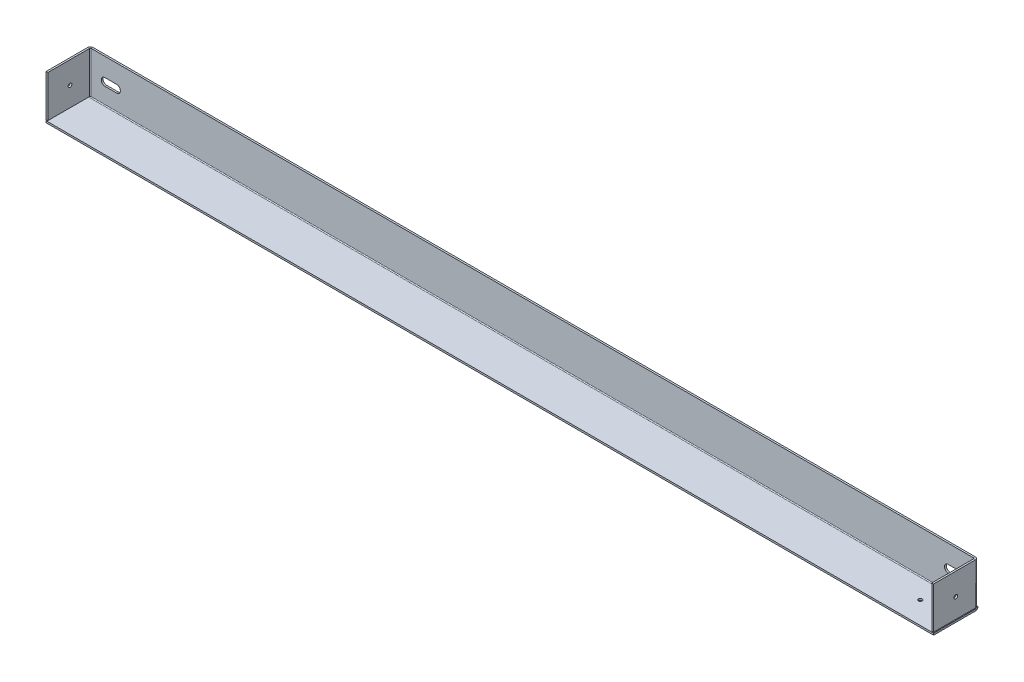
from build123d import *

# Parameters (mm, degrees)
BASEFLANGE_W                 = 1000
BASEFLANGE_H                 = 50
BASEFLANGE1_DEPTH            = 2
EDGE_FLANGE2_STRIP_W         = 10
EDGE_FLANGE2_STRIP_H         = 2
EDGE_FLANGE2_STRIP_CUT_DEPTH = 1000
EDGE_FLANGE2_DEPTH           = 1000
SKETCH12_R                   = 2.1
F_4_2MM_HOLE_DEPTH           = 10
SLOT_1_DEPTH                 = 10
LEFT_EDGE_STRIP_W            = 10
LEFT_EDGE_STRIP_H            = 2
LEFT_EDGE_STRIP_CUT_DEPTH    = 47
LEFT_EDGE_DEPTH              = 47
CUT_EXTRUDE1_DEPTH           = 1002.561281201
CUT_EXTRUDE1_DEPTH_BACK      = 1002.561281201
SKETCH19_R                   = 2.1
RIGHT_EDGE_STRIP_W           = 10
RIGHT_EDGE_STRIP_H           = 2
RIGHT_EDGE_STRIP_CUT_DEPTH   = 47
RIGHT_EDGE_DEPTH             = 47
CUT_EXTRUDE2_START           = -10
SKETCH25_R                   = 2.1
CUT_EXTRUDE2_DEPTH           = 10


# Sheet-metal steps are written as plain solids
with BuildPart() as part:
    # BaseFlange → BaseFlange1 (new body)
    with BuildSketch(Plane.XY):
        Rectangle(BASEFLANGE_W, BASEFLANGE_H)
    extrude(amount=BASEFLANGE1_DEPTH)

    # Edge-Flange2 strip (across the edge) → Edge-Flange2 strip cut (cut)
    with BuildSketch(Plane(origin=(-500, -25, 2), x_dir=(0, 1, 0), z_dir=(1, 0, 0))):
        with Locations((-2, -1)):
            Rectangle(EDGE_FLANGE2_STRIP_W, EDGE_FLANGE2_STRIP_H)
    extrude(amount=EDGE_FLANGE2_STRIP_CUT_DEPTH, mode=Mode.SUBTRACT)

    # Edge-Flange2 section (across the edge) → Edge-Flange2 (add)
    with BuildSketch(Plane(origin=(-500, -25, 2), x_dir=(0, 1, 0), z_dir=(1, 0, 0))):
        with BuildLine():
            Line((0, 1), (0, 48))
            Line((0, 48), (2, 48))
            Line((2, 48), (2, 1))
            ThreePointArc((2, 1), (2.292893219, 0.292893219), (3, 0))
            Line((3, 0), (3, -2))
            ThreePointArc((3, -2), (0.878679656, -1.121320344), (0, 1))
        make_face()
    extrude(amount=EDGE_FLANGE2_DEPTH)

    # Sketch12 → 4.2mm Hole (cut)
    with BuildSketch(Plane(origin=(0, -23, 0), x_dir=(1, 0, 0), z_dir=(0, 1, 0))):
        with Locations(Location((460, -25, 0), (0, 0, 270))):
            Circle(SKETCH12_R)
    extrude(amount=-F_4_2MM_HOLE_DEPTH, mode=Mode.SUBTRACT)

    # slot1 → Slot 1 (cut)
    with BuildSketch(Plane.XY.offset(2)):
        with BuildLine():
            Line((468.5, 4.25), (481.5, 4.25))
            ThreePointArc((481.5, 4.25), (485.75, 0), (481.5, -4.25))
            Line((481.5, -4.25), (468.5, -4.25))
            ThreePointArc((468.5, -4.25), (464.25, 0), (468.5, 4.25))
        make_face()
    slot_1 = extrude(amount=-SLOT_1_DEPTH, mode=Mode.SUBTRACT)

    # Slot Pattern: Slot 1 at 1 more place
    with Locations((-950, 0, 0)):
        add(slot_1, mode=Mode.SUBTRACT)

    # Left Edge strip (across the edge) → Left Edge strip cut (cut)
    with BuildSketch(Plane(origin=(-500, 25, 2), x_dir=(1, 0, 0), z_dir=(0, -1, 0))):
        with Locations((-2, -1)):
            Rectangle(LEFT_EDGE_STRIP_W, LEFT_EDGE_STRIP_H)
    extrude(amount=LEFT_EDGE_STRIP_CUT_DEPTH, mode=Mode.SUBTRACT)

    # Left Edge section (across the edge) → Left Edge (add)
    with BuildSketch(Plane(origin=(-500, 25, 2), x_dir=(1, 0, 0), z_dir=(0, -1, 0))):
        with BuildLine():
            Line((0, 1), (0, 48))
            Line((0, 48), (2, 48))
            Line((2, 48), (2, 1))
            ThreePointArc((2, 1), (2.292893219, 0.292893219), (3, 0))
            Line((3, 0), (3, -2))
            ThreePointArc((3, -2), (0.878679656, -1.121320344), (0, 1))
        make_face()
    extrude(amount=LEFT_EDGE_DEPTH)

    # Sketch19 → Cut-Extrude1 (cut, two sides: drawn at the far end of the back side and taken through both)
    with BuildSketch(Plane.ZY.offset(500).offset(-CUT_EXTRUDE1_DEPTH_BACK)):
        with Locations((25, 0)):
            Circle(SKETCH19_R)
    extrude(amount=CUT_EXTRUDE1_DEPTH + CUT_EXTRUDE1_DEPTH_BACK, mode=Mode.SUBTRACT)

    # Right Edge strip (across the edge) → Right Edge strip cut (cut)
    with BuildSketch(Plane(origin=(500, -22, 2), x_dir=(-1, 0, 0), z_dir=(0, 1, 0))):
        with Locations((-2, -1)):
            Rectangle(RIGHT_EDGE_STRIP_W, RIGHT_EDGE_STRIP_H)
    extrude(amount=RIGHT_EDGE_STRIP_CUT_DEPTH, mode=Mode.SUBTRACT)

    # Right Edge section (across the edge) → Right Edge (add)
    with BuildSketch(Plane(origin=(500, -22, 2), x_dir=(-1, 0, 0), z_dir=(0, 1, 0))):
        with BuildLine():
            Line((0, 1), (0, 48))
            Line((0, 48), (2, 48))
            Line((2, 48), (2, 1))
            ThreePointArc((2, 1), (2.292893219, 0.292893219), (3, 0))
            Line((3, 0), (3, -2))
            ThreePointArc((3, -2), (0.878679656, -1.121320344), (0, 1))
        make_face()
    extrude(amount=RIGHT_EDGE_DEPTH)

    # Sketch25 → Cut-Extrude2 (cut)
    with BuildSketch(Plane(origin=(500, 0, 0), x_dir=(0, 0, -1), z_dir=(1, 0, 0)).offset(CUT_EXTRUDE2_START)):
        with Locations(Location((-25, 0, 0), (0, 0, 180))):
            Circle(SKETCH25_R)
    extrude(amount=CUT_EXTRUDE2_DEPTH, mode=Mode.SUBTRACT)


solid = part.part
